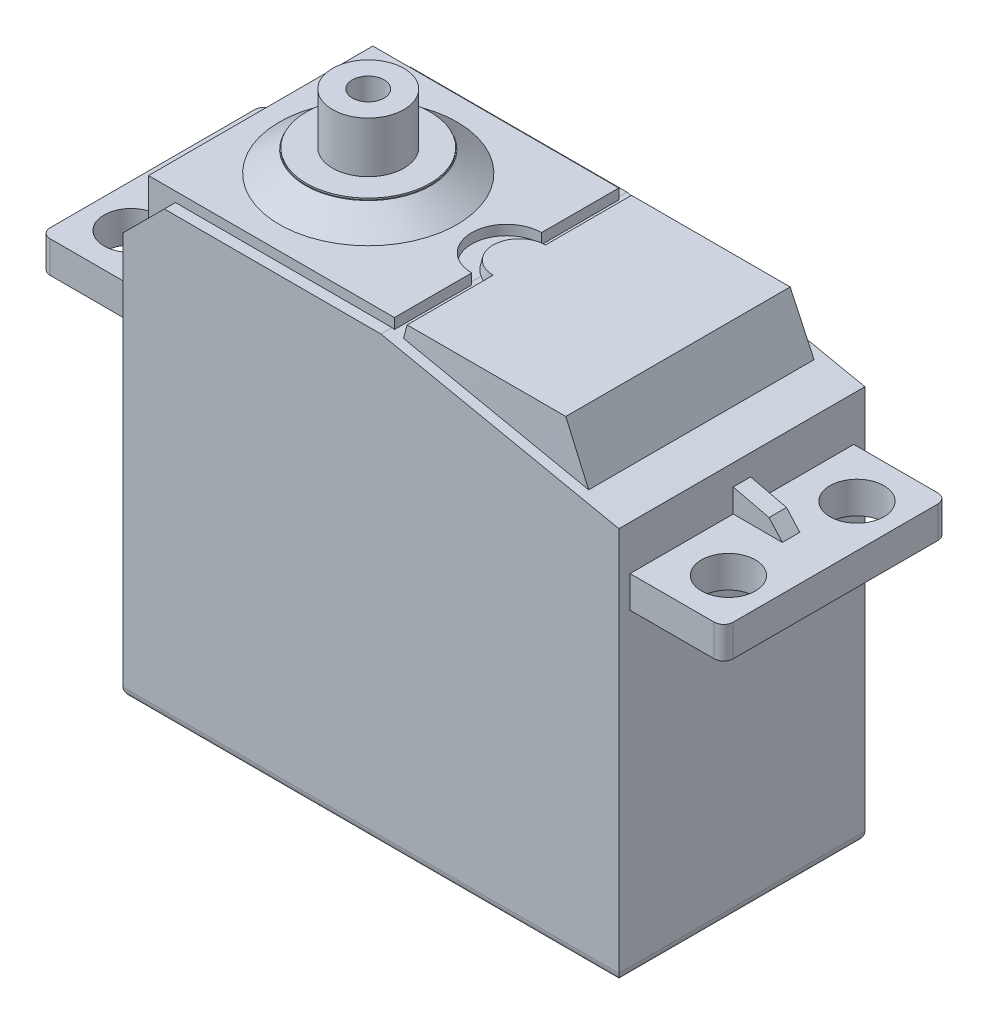
from build123d import *

# Parameters (mm, degrees)
EXTRUDE1_DEPTH     = 19.685
CHAMFER1_SIZE      = 3.302
FILLET1_R          = 0.762
SKETCH2_W          = 17.907
SKETCH2_H          = 2.54
EXTRUDE2_DEPTH     = 7.493
SKETCH4_W          = 17.907
SKETCH4_H          = 2.54
EXTRUDE3_DEPTH     = 7.493
FILLET2_R          = 0.762
EXTRUDE4_DEPTH     = 36.35375
SKETCH10_R         = 2.159
CUT_EXTRUDE1_DEPTH = 36.35375
RIB2_START         = -0.6985
RIB2_DEPTH         = 1.397
RIB3_START         = -0.6985
RIB3_DEPTH         = 1.397
SKETCH16_R         = 5.0165
EXTRUDE5_DEPTH     = 1.651
SKETCH18_R         = 4.953
EXTRUDE6_DEPTH     = 0.127
SKETCH19_R         = 2.159
CUT_EXTRUDE2_DEPTH = 59.305619446
SKETCH20_R         = 2.8575
SKETCH20_R_2       = 1.27
EXTRUDE7_DEPTH     = 4.064
SKETCH22_W         = 5.715
SKETCH22_H         = 3.175
EXTRUDE8_DEPTH     = 1.905
SKETCH24_R         = 0.635


with BuildPart() as part:
    # Sketch1 → Extrude1 (new body)
    with BuildSketch(Plane.XY):
        Polygon((0, 0), (39.6875, 0), (39.6875, 31.59125), (20.6375, 35.56), (0, 35.56), align=None)
    extrude(amount=EXTRUDE1_DEPTH)

    # Chamfer1
    chamfer1_edges = [part.edges().sort_by_distance(p)[0] for p in [
        (0, 35.56, 9.8425),
    ]]
    chamfer(chamfer1_edges, length=CHAMFER1_SIZE)

    # Fillet1
    fillet1_edges = [part.edges().sort_by_distance(p)[0] for p in [
        (19.84375, 0, 0),
        (19.84375, 0, 19.685),
        (39.6875, 0, 9.8425),
        (0, 0, 9.8425),
    ]]
    fillet(fillet1_edges, radius=FILLET1_R)

    # Sketch2 → Extrude2 (add)
    with BuildSketch(Plane(origin=(39.6875, 0, 0), x_dir=(0, 0, -1), z_dir=(1, 0, 0))):
        with Locations((-9.8425, 26.76525)):
            Rectangle(SKETCH2_W, SKETCH2_H)
    extrude(amount=EXTRUDE2_DEPTH)

    # Sketch4 → Extrude3 (add)
    with BuildSketch(Plane.ZY):
        with Locations((9.8425, 26.76652)):
            Rectangle(SKETCH4_W, SKETCH4_H)
    extrude(amount=EXTRUDE3_DEPTH)

    # Fillet2
    fillet2_edges = [part.edges().sort_by_distance(p)[0] for p in [
        (47.1805, 26.76525, 18.796),
        (47.1805, 26.76525, 0.889),
        (-7.493, 26.76652, 0.889),
        (-7.493, 26.76652, 18.796),
    ]]
    fillet(fillet2_edges, radius=FILLET2_R)

    # Sketch5 → Extrude4 (add)
    with BuildSketch(Plane(origin=(0, 0, 0), x_dir=(1, 0, 0), z_dir=(0, 1, 0))):
        with BuildLine():
            Line((1.143, -0.837535442), (20.828, -0.837535442))
            Line((20.828, -0.837535442), (20.828, -7.022435442))
            ThreePointArc((20.828, -7.022435442), (18.034, -9.816435442), (20.828, -12.610435442))
            Line((20.828, -12.610435442), (20.828, -18.795335442))
            Line((20.828, -18.795335442), (1.143, -18.795335442))
            Line((1.143, -18.795335442), (1.143, -0.837535442))
        make_face()
    extrude(amount=EXTRUDE4_DEPTH)

    # Sketch9 → Loft1 section 0
    with BuildSketch(Plane(origin=(7.958631448, 38.201430948, 0), x_dir=(-0.9789804197376049, 0.20395425411200233, 0), z_dir=(0.20395425411200233, 0.9789804197376049, 0))):
        with BuildLine():
            Line((-29.108115578, 18.877249077), (-13.970346323, 18.877249077))
            Line((-13.970346323, 18.877249077), (-13.970346323, 11.936940395))
            ThreePointArc((-13.970346323, 11.936940395), (-11.890798187, 9.857392259), (-13.970346323, 7.777844123))
            Line((-13.970346323, 7.777844123), (-13.970346323, 0.837535442))
            Line((-13.970346323, 0.837535442), (-29.108115578, 0.837535442))
            Line((-29.108115578, 0.837535442), (-29.108115578, 18.877249077))
        make_face()
    # Sketch7 → Loft1 section 1
    with BuildSketch(Plane(origin=(0, 36.35375, 0), x_dir=(-1, 0, 0), z_dir=(0, 1, 0))):
        with BuildLine():
            Line((-21.844, 0.837535442), (-34.544, 0.837535442))
            Line((-34.544, 0.837535442), (-34.544, 18.795335442))
            Line((-34.544, 18.795335442), (-21.844, 18.795335442))
            Line((-21.844, 18.795335442), (-21.844, 11.911935442))
            ThreePointArc((-21.844, 11.911935442), (-19.7485, 9.816435442), (-21.844, 7.720935442))
            Line((-21.844, 7.720935442), (-21.844, 0.837535442))
        make_face()
    loft()

    # Sketch10 → Cut-Extrude1 (cut)
    with BuildSketch(Plane(origin=(0, 28.03525, 0), x_dir=(-1, 0, 0), z_dir=(0, 1, 0))):
        with Locations(Location((-43.7515, 4.699, 0), (0, 0, 90))):
            Circle(SKETCH10_R)
        with Locations(Location((-43.7515, 14.986, 0), (0, 0, 90))):
            Circle(SKETCH10_R)
    extrude(amount=-CUT_EXTRUDE1_DEPTH, mode=Mode.SUBTRACT)

    # Rib2: read off the stored shape, not the designer's step
    # Rib2 outline → Rib2 (add)
    with BuildSketch(Plane.XY.offset(9.8425).offset(RIB2_START)):
        Polygon((43.622065389, 28.03525), (42.556674437, 29.225981064), (39.6875, 29.914582929), (39.6875, 28.03525), align=None)
    extrude(amount=RIB2_DEPTH)

    # Rib3: read off the stored shape, not the designer's step
    # Rib3 outline → Rib3 (add)
    with BuildSketch(Plane.XY.offset(9.8425).offset(RIB3_START)):
        Polygon((0, 29.585656003), (-3.58232689, 28.876779051), (-4.304067283, 28.03652), (0, 28.03652), align=None)
    extrude(amount=RIB3_DEPTH)

    # Sketch16 → Extrude5 (add)
    with BuildSketch(Plane(origin=(0, 36.35375, 0), x_dir=(-1, 0, 0), z_dir=(0, 1, 0))):
        with Locations(Location((-9.77846774, 9.8425, 0), (0, 0, 270))):
            Circle(SKETCH16_R)
    extrude(amount=EXTRUDE5_DEPTH)

    # Loft2: read off the stored shape, not the designer's step
    # Loft2: loft between two sections, ruled curve by curve
    loft2_from = [
        Edge.make_bspline([(10.784981125, 36.35375, 2.802082768), (-3.29585334, 36.35375, 0.789055998), (-5.308880109, 36.35375, 14.869890463), (8.771954355, 36.35375, 16.882917232), (22.85278882, 36.35375, 18.895944002), (24.865815589, 36.35375, 4.815109537), (10.784981125, 36.35375, 2.802082768)], [0, 0, 0, 0, 0.5, 0.5, 0.5, 1, 1, 1, 1], 3, [1, 0.333333333, 0.333333333, 1, 0.333333333, 0.333333333, 1]),
    ]
    loft2_to = [
        Edge.make_bspline([(9.491795646, 38.00475, 4.834197757), (-0.52480884, 38.00475, 5.407541944), (0.048535347, 38.00475, 15.424146431), (10.065139834, 38.00475, 14.850802243), (20.08174432, 38.00475, 14.277458056), (19.508400133, 38.00475, 4.260853569), (9.491795646, 38.00475, 4.834197757)], [0, 0, 0, 0, 0.5, 0.5, 0.5, 1, 1, 1, 1], 3, [1, 0.333333333, 0.333333333, 1, 0.333333333, 0.333333333, 1]),
    ]
    loft2 = Solid(Shell([*[Face.make_surface_from_curves(loft2_from[k], loft2_to[k]) for k in range(1)], Face(Wire(loft2_from)), Face(Wire(loft2_to))]))
    add(loft2)

    # Sketch18 → Extrude6 (add)
    with BuildSketch(Plane(origin=(0, 38.00475, 0), x_dir=(-1, 0, 0), z_dir=(0, 1, 0))):
        with Locations(Location((-9.77846774, 9.8425, 0), (0, 0, 90))):
            Circle(SKETCH18_R)
    extrude(amount=EXTRUDE6_DEPTH)

    # Sketch19 → Cut-Extrude2 (cut, through all)
    with BuildSketch(Plane(origin=(0, 28.03652, 0), x_dir=(-1, 0, 0), z_dir=(0, 1, 0))):
        with Locations(Location((4.064, 4.699, 0), (0, 0, 90))):
            Circle(SKETCH19_R)
        with Locations(Location((4.064, 14.986, 0), (0, 0, 90))):
            Circle(SKETCH19_R)
    extrude(amount=-CUT_EXTRUDE2_DEPTH, mode=Mode.SUBTRACT)

    # Sketch20 → Extrude7 (add)
    with BuildSketch(Plane(origin=(0, 38.13175, 0), x_dir=(-1, 0, 0), z_dir=(0, 1, 0))):
        with Locations(Location((-9.77846774, 9.8425, 0), (0, 0, 90))):
            Circle(SKETCH20_R)
        with Locations(Location((-9.77846774, 9.8425, 0), (0, 0, 90))):
            Circle(SKETCH20_R_2, mode=Mode.SUBTRACT)
    extrude(amount=EXTRUDE7_DEPTH)

    # Sketch22 → Extrude8 (add)
    with BuildSketch(Plane.ZY):
        with Locations((9.8425, 2.8575)):
            Rectangle(SKETCH22_W, SKETCH22_H)
    extrude(amount=EXTRUDE8_DEPTH)

    # Sketch21 → section 0 of loft3
    with BuildSketch(Plane.ZY, mode=Mode.PRIVATE) as loft3_s0:
        with BuildLine():
            Line((6.477, 4.953), (13.208, 4.953))
            Line((13.208, 4.953), (13.208, 0.762))
            Line((13.208, 0.762), (6.477, 0.762))
            Line((6.477, 0.762), (6.477, 4.953))
        make_face()
    # loft up to a face of the part (loft3)
    loft([loft3_s0.sketch, part.faces().sort_by_distance((-1.905, 2.8575, 9.8425))[0]])

    # Sweep3: sweep along a path in Sketch23
    with BuildLine(Plane.XY.offset(9.8425)) as sweep3_path:
        ThreePointArc((-1.905, 2.946484605), (-3.908218654, 2.753050744), (-5.763136487, 1.972293764))
    # Sketch24 → Sweep3 (sweep)
    with BuildSketch(Plane.ZY.offset(1.905)):
        with Locations((9.8425, 2.946484605)):
            Circle(SKETCH24_R)
        with Locations((11.23883905, 2.946484605)):
            Circle(SKETCH24_R)
        with Locations((8.466018651, 2.946484605)):
            Circle(SKETCH24_R)
    sweep(path=sweep3_path.line)


solid = part.part
